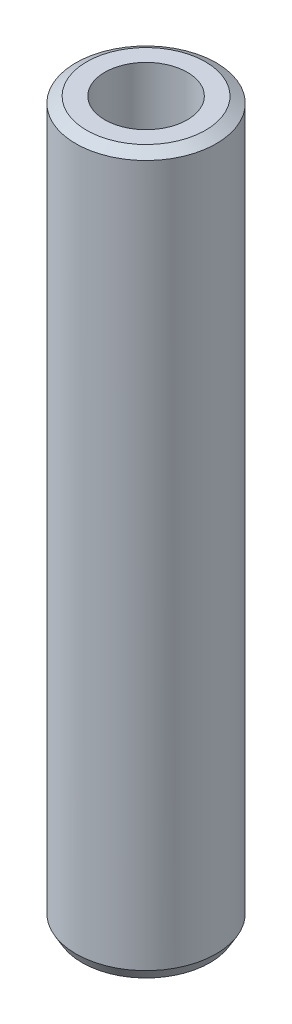
from build123d import *
from OCP.BRepFilletAPI import BRepFilletAPI_MakeChamfer

# Parameters (mm, degrees)
SKETCH1_R           = 40
BOSS_EXTRUDE1_DEPTH = 409.588902548
SKETCH2_R           = 23.512632721
CUT_EXTRUDE1_DEPTH  = 414.476805988
CHAMFER1_SIZE       = 3.552002206
CHAMFER1_SIZE2      = 6.15224829


with BuildPart() as part:
    # Sketch1 → Boss-Extrude1 (new body)
    with BuildSketch(Plane(origin=(0, 0, 0), x_dir=(1, 0, 0), z_dir=(0, 1, 0))):
        Circle(SKETCH1_R)
    extrude(amount=BOSS_EXTRUDE1_DEPTH)

    # Sketch2 → Cut-Extrude1 (cut, through all)
    with BuildSketch(Plane(origin=(0, 0, 0), x_dir=(1, 0, 0), z_dir=(0, 1, 0))):
        Circle(SKETCH2_R)
    extrude(amount=CUT_EXTRUDE1_DEPTH, mode=Mode.SUBTRACT)

    # Chamfer1: one chamfer whose edges measure the first distance from different faces: ONE call of the kernel's chamfer builder (chamfer() names one face for all edges)
    chamfer1_edges_1 = [part.edges().sort_by_distance(p)[0] for p in [
        (-40, 409.588902548, 0),
    ]]
    chamfer1_side_1 = [part.faces().sort_by_distance(p)[0] for p in [
        (-40, 204.794451274, 0),
    ]]
    chamfer1_edges_2 = [part.edges().sort_by_distance(p)[0] for p in [
        (-40, 0, 0),
    ]]
    chamfer1_side_2 = [part.faces().sort_by_distance(p)[0] for p in [
        (-38.86862915, 0, 0),
    ]]
    chamfer1 = BRepFilletAPI_MakeChamfer(part.part.solid().wrapped)
    for e in chamfer1_edges_1:
        chamfer1.Add(CHAMFER1_SIZE, CHAMFER1_SIZE2, e.wrapped, chamfer1_side_1[0].wrapped)  # the first distance lies on this face
    for e in chamfer1_edges_2:
        chamfer1.Add(CHAMFER1_SIZE, CHAMFER1_SIZE2, e.wrapped, chamfer1_side_2[0].wrapped)  # the first distance lies on this face
    add(Compound.cast(chamfer1.Shape()), mode=Mode.REPLACE)


solid = part.part
